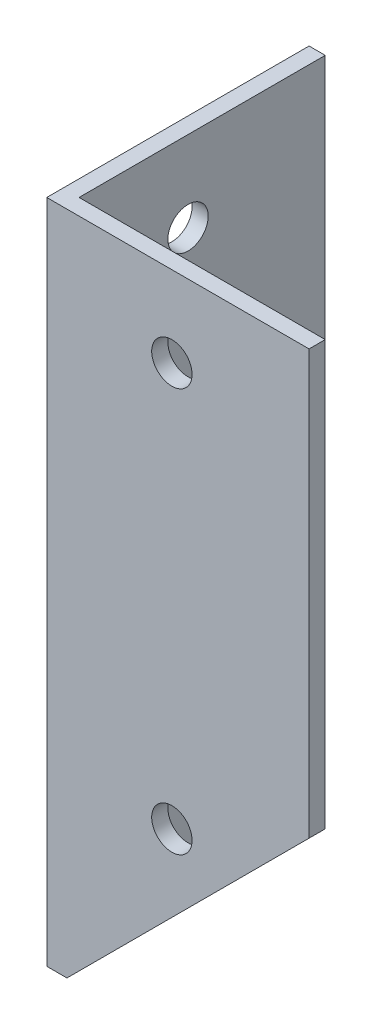
from build123d import *

# Parameters (mm, degrees)
EXTRUDE_1_DEPTH     = 165
SKETCH_2_R          = 5
CUT_EXTRUDE_1_DEPTH = 10
SKETCH_3_R          = 5
CUT_EXTRUDE_2_DEPTH = 10
CUT_EXTRUDE_3_DEPTH = 189.878267675


with BuildPart() as part:
    # Эскиз1 → Вытянуть-Тонкостенный1 (new body)
    with BuildSketch(Plane(origin=(0, 0, 0), x_dir=(1, 0, 0), z_dir=(0, 1, 0))):
        Polygon((0, 65), (0, 0), (65, 0), (65, 4), (4, 4), (4, 65), align=None)
    extrude(amount=EXTRUDE_1_DEPTH)

    # Эскиз2 → Вырез-Вытянуть1 (cut)
    with BuildSketch(Plane.XY):
        with Locations((31, 145)):
            Circle(SKETCH_2_R)
        with Locations((31, 45)):
            Circle(SKETCH_2_R)
    extrude(amount=-CUT_EXTRUDE_1_DEPTH, mode=Mode.SUBTRACT)

    # Эскиз3 → Вырез-Вытянуть2 (cut)
    with BuildSketch(Plane.ZY):
        with Locations((-31, 145)):
            Circle(SKETCH_3_R)
        with Locations((-31, 45)):
            Circle(SKETCH_3_R)
        with Locations((-15, 10)):
            Circle(SKETCH_3_R)
        with Locations((-45, 10)):
            Circle(SKETCH_3_R)
    extrude(amount=-CUT_EXTRUDE_2_DEPTH, mode=Mode.SUBTRACT)

    # Эскиз4 → Вырез-Вытянуть3 (cut, through all)
    with BuildSketch(Plane.XY):
        Polygon((5, 0), (65, 60), (65, 0), align=None)
    extrude(amount=-CUT_EXTRUDE_3_DEPTH, mode=Mode.SUBTRACT)


solid = part.part
